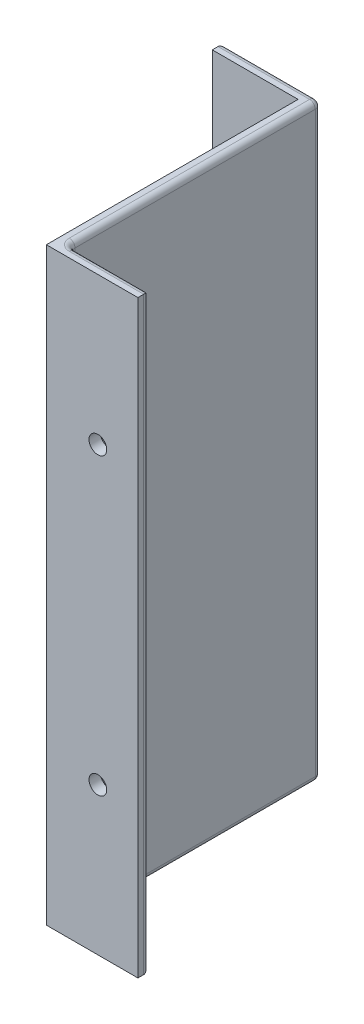
from build123d import *

# Parameters (mm, degrees)
RESSALTO_EXTRUS_O1_DEPTH = 103
ESBO_O2_R                = 1.55
CORTE_EXTRUS_O1_DEPTH    = 2
CORTE_EXTRUS_O2_DEPTH    = 0.5
FILETE1_R                = 1


with BuildPart() as part:
    # Esboço1 → Ressalto-extrusão1 (new body)
    with BuildSketch(Plane(origin=(0, 0, 0), x_dir=(1, 0, 0), z_dir=(0, 1, 0))):
        Polygon((0, 0), (16, 0), (16, 2), (2, 2), (2, 46), (-15, 46), (-15, 44), (0, 44), align=None)
    extrude(amount=RESSALTO_EXTRUS_O1_DEPTH)

    # Esboço2 → Corte-extrusão1 (cut)
    with BuildSketch(Plane(origin=(0, 0, -2), x_dir=(-1, 0, 0), z_dir=(0, 0, -1))):
        with Locations((-9, 77.25)):
            Circle(ESBO_O2_R)
        with Locations((-9, 25.75)):
            Circle(ESBO_O2_R)
    extrude(amount=-CORTE_EXTRUS_O1_DEPTH, mode=Mode.SUBTRACT)

    # Esboço3 → Corte-extrusão2 (cut)
    # profile 1 of 8: a face of its own
    with BuildSketch(Plane(origin=(0, 0, -2), x_dir=(-1, 0, 0), z_dir=(0, 0, -1))):
        Polygon((-12.5, 60.721153846), (-12.5, 61.057692308), (-9.743890224, 62.223657853), (-12.5, 63.390324519), (-12.5, 63.727564103), (-9, 62.246794872), (-9, 62.201923077), align=None)
    # profile 2 of 8: a face of its own
    with BuildSketch(Plane(origin=(0, 0, -2), x_dir=(-1, 0, 0), z_dir=(0, 0, -1))):
        with BuildLine():
            Line((-11.423076923, 58.432692308), (-11.423076923, 58.118589744))
            add(Edge.make_bspline(
                [(-11.423076923, 58.118589744), (-11.464747811, 58.120636897), (-11.546588325, 58.124657451), (-11.665912232, 58.14348574), (-11.779967031, 58.170426617), (-11.887836945, 58.208518071), (-11.990475752, 58.255824349), (-12.087475767, 58.312554376), (-12.178466956, 58.379748227), (-12.262605799, 58.455954961), (-12.33979337, 58.5387236), (-12.406448613, 58.628029539), (-12.462766284, 58.721874567), (-12.509847526, 58.819973966), (-12.545187372, 58.923434529), (-12.571409012, 59.031317387), (-12.587185357, 59.144096523), (-12.588881143, 59.220936545), (-12.58974359, 59.260016026)],
                knots=[0, 0, 0, 0, 1.10065271, 2.161652631, 3.183658789, 4.190468796, 5.17591951, 6.163126047, 7.15150782, 8.156236427, 9.156009102, 10.134482811, 11.092018607, 12.041330605, 13.001268258, 13.972401359, 14.968799086, 16, 16, 16, 16], degree=3))
            add(Edge.make_bspline(
                [(-12.58974359, 59.260016026), (-12.588852424, 59.298396801), (-12.587101316, 59.373813652), (-12.571837144, 59.483837459), (-12.54844616, 59.588826559), (-12.513784407, 59.687591109), (-12.47029149, 59.781144713), (-12.416202348, 59.868329021), (-12.354076299, 59.951252241), (-12.280795578, 60.025844646), (-12.202604863, 60.094366768), (-12.119097837, 60.153428695), (-12.032749001, 60.204293291), (-11.942883845, 60.245924374), (-11.849209723, 60.277482586), (-11.752624723, 60.300864197), (-11.652014188, 60.314230389), (-11.583905673, 60.316270491), (-11.549278846, 60.317307692)],
                knots=[0, 0, 0, 0, 1.111674182, 2.184400057, 3.212814286, 4.223731311, 5.211378316, 6.196328225, 7.191884489, 8.207283132, 9.220262353, 10.201199469, 11.166417575, 12.120932471, 13.06540007, 14.026332106, 14.996573967, 16, 16, 16, 16], degree=3))
            add(Edge.make_bspline(
                [(-11.549278846, 60.317307692), (-11.500530165, 60.315615866), (-11.403888274, 60.312261902), (-11.261885815, 60.283526473), (-11.12424519, 60.238760085), (-11.013479624, 60.184415929), (-10.924023761, 60.130564808), (-10.8505287, 60.081718469), (-10.771712368, 60.024110035), (-10.686615211, 59.95820849), (-10.596722591, 59.882657453), (-10.499528359, 59.800472163), (-10.398131849, 59.707985246), (-10.328796454, 59.643361966), (-10.29286859, 59.609875801)],
                knots=[0, 0, 0, 0, 1.184287764, 2.347792955, 3.508658517, 4.695561027, 5.337795753, 6.047029248, 6.840419152, 7.71111932, 8.663527678, 9.695323177, 10.80577421, 12, 12, 12, 12], degree=3))
            Line((-10.29286859, 59.609875801), (-9.358974359, 58.734174679))
            Line((-9.358974359, 58.734174679), (-9.358974359, 60.362179487))
            Line((-9.358974359, 60.362179487), (-9, 60.362179487))
            Line((-9, 60.362179487), (-9, 57.983974359))
            Line((-9, 57.983974359), (-10.448517628, 59.341346154))
            add(Edge.make_bspline(
                [(-10.448517628, 59.341346154), (-10.483015935, 59.374394041), (-10.549280121, 59.437872268), (-10.646023081, 59.527654845), (-10.735772622, 59.608293833), (-10.818359171, 59.680311226), (-10.894990738, 59.742144731), (-10.963185442, 59.797016963), (-11.025939892, 59.840982554), (-11.098680506, 59.88869795), (-11.187492823, 59.934911931), (-11.296026513, 59.974624287), (-11.407753765, 59.998839136), (-11.483255802, 60.001743971), (-11.521233974, 60.003205128)],
                knots=[0, 0, 0, 0, 1.329631726, 2.553950428, 3.673215718, 4.687767853, 5.603093632, 6.413772471, 7.123043292, 7.734684054, 8.834405432, 9.900288307, 10.943827018, 12, 12, 12, 12], degree=3))
            add(Edge.make_bspline(
                [(-11.521233974, 60.003205128), (-11.545115373, 60.002569386), (-11.592181023, 60.00131646), (-11.661186782, 59.990258762), (-11.727751596, 59.973548256), (-11.792080215, 59.949602998), (-11.853525867, 59.917996258), (-11.912163347, 59.879522878), (-11.968852313, 59.835132815), (-12.022005611, 59.783781546), (-12.070686816, 59.727370026), (-12.113810902, 59.667775776), (-12.149850012, 59.604725672), (-12.179393509, 59.53848555), (-12.202568891, 59.46924008), (-12.21862747, 59.396855335), (-12.228709954, 59.321531319), (-12.230074126, 59.270097823), (-12.230769231, 59.243890224)],
                knots=[0, 0, 0, 0, 0.991446411, 1.95395049, 2.89581595, 3.838931463, 4.798493298, 5.75982156, 6.748411868, 7.785213223, 8.824556874, 9.840280684, 10.836137867, 11.835679398, 12.848801643, 13.863922112, 14.911575587, 16, 16, 16, 16], degree=3))
            add(Edge.make_bspline(
                [(-12.230769231, 59.243890224), (-12.230082413, 59.216512522), (-12.228733615, 59.162747234), (-12.218517149, 59.083975444), (-12.203028983, 59.008311704), (-12.178430394, 58.936884984), (-12.149365939, 58.868148585), (-12.11244268, 58.803569919), (-12.069537034, 58.742076784), (-12.019786187, 58.684680621), (-11.963887514, 58.632259658), (-11.902283318, 58.585553337), (-11.835417099, 58.545012256), (-11.76356329, 58.509591138), (-11.686006495, 58.480838784), (-11.603039645, 58.458864688), (-11.515018024, 58.441478106), (-11.454232973, 58.435669548), (-11.423076923, 58.432692308)],
                knots=[0, 0, 0, 0, 1.030878251, 2.024474673, 2.987898669, 3.934362936, 4.864849709, 5.795128259, 6.730474222, 7.685293701, 8.650606017, 9.611896181, 10.591709709, 11.591680886, 12.625074257, 13.701333388, 14.821793024, 16, 16, 16, 16], degree=3))
        make_face()
    # profile 3 of 8: a face of its own
    with BuildSketch(Plane(origin=(0, 0, -2), x_dir=(-1, 0, 0), z_dir=(0, 0, -1))):
        Polygon((-12.5, 56.035556891), (-12.5, 56.682692308), (-9, 56.682692308), (-9, 56.368589744), (-12.141025641, 56.368589744), (-12.141025641, 55.830128205), align=None)
    # profile 4 of 8: a face of its own
    with BuildSketch(Plane(origin=(0, 0, -2), x_dir=(-1, 0, 0), z_dir=(0, 0, -1))):
        Polygon((-12.5, 51.657051282), (-12.5, 53.631410256), (-12.141025641, 53.631410256), (-12.141025641, 51.971153846), (-11.064102564, 51.971153846), (-11.064102564, 53.631410256), (-10.705128205, 53.631410256), (-10.705128205, 51.971153846), (-9.358974359, 51.971153846), (-9.358974359, 53.631410256), (-9, 53.631410256), (-9, 51.657051282), align=None)
    # profile 5 of 8: a face of its own
    with BuildSketch(Plane(origin=(0, 0, -2), x_dir=(-1, 0, 0), z_dir=(0, 0, -1))):
        Polygon((-12.141025641, 49.189102564), (-12.5, 49.189102564), (-12.5, 51.028846154), (-12.141025641, 51.028846154), (-12.141025641, 50.266025641), (-9, 50.266025641), (-9, 49.951923077), (-12.141025641, 49.951923077), align=None)
    # profile 6 of 8: a face of its own
    with BuildSketch(Plane(origin=(0, 0, -2), x_dir=(-1, 0, 0), z_dir=(0, 0, -1))):
        Polygon((-9, 46.003205128), (-12.5, 46.003205128), (-12.5, 46.069110577), (-9.745292468, 48.381410256), (-12.5, 48.381410256), (-12.5, 48.695512821), (-9, 48.695512821), (-9, 48.623998397), (-11.748397436, 46.317307692), (-9, 46.317307692), align=None)
    # profile 7 of 8: a face of its own
    with BuildSketch(Plane(origin=(0, 0, -2), x_dir=(-1, 0, 0), z_dir=(0, 0, -1))):
        with BuildLine():
            add(Edge.make_bspline(
                [(-12.58974359, 43.423076923), (-12.588129744, 43.487892095), (-12.584960018, 43.61519444), (-12.559895231, 43.802115963), (-12.518641215, 43.981101701), (-12.460381735, 44.152254553), (-12.384855641, 44.314923583), (-12.293113066, 44.469568209), (-12.184596472, 44.615724978), (-12.060899323, 44.752387834), (-11.925430757, 44.877056019), (-11.780409088, 44.986452998), (-11.62765762, 45.078739675), (-11.467168388, 45.154286371), (-11.299316087, 45.213595534), (-11.123159994, 45.2545117), (-10.939853875, 45.280650636), (-10.814826932, 45.283706305), (-10.751402244, 45.28525641)],
                knots=[0, 0, 0, 0, 1.065064174, 2.09187391, 3.093564831, 4.079973196, 5.057907931, 6.036227367, 7.030399151, 8.044883615, 9.061699972, 10.052012555, 11.025713132, 11.989727027, 12.962874294, 13.945865945, 14.957962116, 16, 16, 16, 16], degree=3))
            add(Edge.make_bspline(
                [(-10.751402244, 45.28525641), (-10.688445124, 45.283705784), (-10.564349346, 45.280649319), (-10.382201223, 45.254490491), (-10.207127705, 45.213412964), (-10.039519009, 45.155020699), (-9.879355736, 45.079416032), (-9.726488631, 44.986993495), (-9.581079609, 44.877804139), (-9.444677774, 44.753665359), (-9.319901677, 44.617938723), (-9.2098443, 44.473474414), (-9.11751745, 44.320727019), (-9.041127343, 44.161279455), (-8.983054174, 43.993879686), (-8.94077499, 43.819745885), (-8.914895539, 43.637929312), (-8.911819755, 43.514074262), (-8.91025641, 43.451121795)],
                knots=[0, 0, 0, 0, 1.043748596, 2.057349401, 3.045489418, 4.02252776, 4.995289225, 5.97782527, 6.980224157, 8.006516136, 9.032559198, 10.034193337, 11.013412982, 11.987833483, 12.961212594, 13.946489799, 14.956251404, 16, 16, 16, 16], degree=3))
            add(Edge.make_bspline(
                [(-8.91025641, 43.451121795), (-8.911805797, 43.387697476), (-8.914860051, 43.26267126), (-8.941041456, 43.079134225), (-8.98198276, 42.902856481), (-9.040492196, 42.73434213), (-9.116109427, 42.5734972), (-9.208313806, 42.420007117), (-9.317720947, 42.27448797), (-9.441887521, 42.138146223), (-9.577059073, 42.013397025), (-9.721893329, 41.90463765), (-9.873548785, 41.812412536), (-10.032446309, 41.737049204), (-10.197817752, 41.677384744), (-10.370766229, 41.636679926), (-10.550305735, 41.610343974), (-10.672548634, 41.607309128), (-10.734575321, 41.605769231)],
                knots=[0, 0, 0, 0, 1.053102029, 2.075944431, 3.073151272, 4.055350789, 5.033113405, 6.020478099, 7.024410459, 8.052272461, 9.079885166, 10.07527673, 11.055994387, 12.023226415, 12.992069828, 13.970394897, 14.97016774, 16, 16, 16, 16], degree=3))
            add(Edge.make_bspline(
                [(-10.734575321, 41.605769231), (-10.77620799, 41.606303866), (-10.858948113, 41.607366393), (-10.981814713, 41.620158085), (-11.102705371, 41.638719786), (-11.221276319, 41.665321699), (-11.337237304, 41.700113366), (-11.451388067, 41.741165393), (-11.56257179, 41.791305239), (-11.671315182, 41.847985887), (-11.775923088, 41.911247695), (-11.874802671, 41.981123444), (-11.968783668, 42.055158813), (-12.055430672, 42.136322206), (-12.137264328, 42.221938651), (-12.213027045, 42.31339703), (-12.283401996, 42.410139274), (-12.346822337, 42.512581654), (-12.404181472, 42.618199929), (-12.453403323, 42.727076706), (-12.495649384, 42.837733278), (-12.529890209, 42.950687926), (-12.556922245, 43.065640698), (-12.575329599, 43.182842482), (-12.588153917, 43.302199909), (-12.589211419, 43.382611228), (-12.58974359, 43.423076923)],
                knots=[0, 0, 0, 0, 1.037015668, 2.060948919, 3.074880161, 4.083647147, 5.086022904, 6.090072063, 7.104153813, 8.122640571, 9.144368836, 10.147691507, 11.138137339, 12.123020368, 13.103399296, 14.087645067, 15.080126199, 16.082011238, 17.087798457, 18.072939717, 19.057185487, 20.037253025, 21.01195951, 21.997135196, 22.992090687, 24, 24, 24, 24], degree=3))
        make_face()
        with BuildLine():
            add(Edge.make_bspline(
                [(-12.230769231, 43.438501603), (-12.230365753, 43.405286544), (-12.229562654, 43.339173966), (-12.21892606, 43.24089571), (-12.203874783, 43.14388013), (-12.182015052, 43.048314965), (-12.153740439, 42.953999796), (-12.119639024, 42.860892752), (-12.078422353, 42.769313065), (-12.032069199, 42.679375145), (-11.979419431, 42.593156263), (-11.92351052, 42.510448779), (-11.862265147, 42.433403984), (-11.797007836, 42.3609635), (-11.727172255, 42.293307478), (-11.653217023, 42.23046576), (-11.574822262, 42.17248988), (-11.492310601, 42.120077551), (-11.40614272, 42.07343467), (-11.317965778, 42.031673343), (-11.226743513, 41.997054796), (-11.133045178, 41.969631749), (-11.037283681, 41.946355866), (-10.93893728, 41.93175551), (-10.838345009, 41.921014112), (-10.770362768, 41.920255499), (-10.735977564, 41.919871795)],
                knots=[0, 0, 0, 0, 1.008406545, 2.007172654, 2.999155034, 3.989332444, 4.982025741, 5.988181096, 6.998684226, 8.030553839, 9.059268815, 10.065399129, 11.060956322, 12.046057109, 13.024974577, 14.012068307, 14.991706172, 15.984221787, 16.978487447, 17.966117052, 18.945677757, 19.938371053, 20.93015022, 21.936155317, 22.956113857, 24, 24, 24, 24], degree=3))
            add(Edge.make_bspline(
                [(-10.735977564, 41.919871795), (-10.685416493, 41.921149574), (-10.585947224, 41.92366336), (-10.440162679, 41.945579314), (-10.299921154, 41.979605997), (-10.166058545, 42.02893826), (-10.037977921, 42.091871297), (-9.916177726, 42.168636824), (-9.80069389, 42.259937855), (-9.692386073, 42.363586807), (-9.593568594, 42.476924205), (-9.50670751, 42.59721416), (-9.433602799, 42.723504981), (-9.372488904, 42.855068762), (-9.326448237, 42.993028771), (-9.293621264, 43.136500462), (-9.272345169, 43.285487005), (-9.270278754, 43.3870127), (-9.269230769, 43.438501603)],
                knots=[0, 0, 0, 0, 1.032022337, 2.030307203, 3.003823408, 3.974715386, 4.937372378, 5.913284036, 6.909147208, 7.938749767, 8.970518239, 9.975863271, 10.963918693, 11.946286286, 12.933361397, 13.927862637, 14.949112547, 16, 16, 16, 16], degree=3))
            add(Edge.make_bspline(
                [(-9.269230769, 43.438501603), (-9.26970589, 43.47311124), (-9.270648197, 43.541752547), (-9.280152496, 43.643846073), (-9.295363267, 43.744109775), (-9.317371822, 43.8423584), (-9.344552167, 43.938720673), (-9.378266584, 44.032905837), (-9.418682089, 44.124882609), (-9.463723833, 44.215103258), (-9.514890039, 44.301547657), (-9.570045247, 44.383753456), (-9.630209968, 44.460665514), (-9.694590845, 44.53307201), (-9.764211752, 44.600253878), (-9.837717532, 44.662916673), (-9.916278677, 44.719890134), (-9.99845239, 44.772124784), (-10.083992054, 44.819336779), (-10.172411414, 44.859890148), (-10.263236245, 44.894523564), (-10.356533279, 44.922442021), (-10.452092652, 44.944330197), (-10.550051131, 44.95940938), (-10.650210365, 44.969958018), (-10.717954236, 44.970753068), (-10.752103365, 44.971153846)],
                knots=[0, 0, 0, 0, 1.047334373, 2.07717862, 3.100662057, 4.115010574, 5.122652213, 6.129548646, 7.140165612, 8.16200981, 9.179904151, 10.178566626, 11.156366481, 12.133321541, 13.108841334, 14.082538371, 15.054589433, 16.043660176, 17.028268541, 18.009491307, 18.985652105, 19.968123554, 20.954864208, 21.950389976, 22.966808393, 24, 24, 24, 24], degree=3))
            add(Edge.make_bspline(
                [(-10.752103365, 44.971153846), (-10.78601887, 44.970752733), (-10.85329652, 44.969957052), (-10.952757338, 44.959414577), (-11.05001055, 44.944313687), (-11.144674352, 44.922550978), (-11.236772879, 44.894500826), (-11.326219621, 44.859913492), (-11.413347837, 44.819128206), (-11.497942055, 44.772319928), (-11.579117087, 44.719704305), (-11.65671841, 44.662209319), (-11.729295218, 44.598846743), (-11.798614701, 44.531410349), (-11.863290324, 44.458278819), (-11.923072192, 44.379439389), (-11.980653876, 44.29685506), (-12.031614304, 44.208658248), (-12.0789118, 44.11796248), (-12.119263823, 44.024812838), (-12.153920496, 43.930539635), (-12.182099457, 43.834765951), (-12.20379105, 43.737537055), (-12.218939529, 43.63890949), (-12.229559, 43.539227521), (-12.23036454, 43.472183455), (-12.230769231, 43.438501603)],
                knots=[0, 0, 0, 0, 1.029877221, 2.042951179, 3.035109885, 4.018542222, 4.991021277, 5.957494829, 6.929429462, 7.911425532, 8.892163142, 9.866273635, 10.842761649, 11.81676864, 12.802607151, 13.805177466, 14.821356543, 15.858816981, 16.897175917, 17.927346774, 18.940346092, 19.946830556, 20.957962087, 21.964146003, 22.97721996, 24, 24, 24, 24], degree=3))
        make_face(mode=Mode.SUBTRACT)
    # profile 8 of 8: a face of its own
    with BuildSketch(Plane(origin=(0, 0, -2), x_dir=(-1, 0, 0), z_dir=(0, 0, -1))):
        Polygon((-12.5, 39.451923077), (-12.5, 41.157051282), (-12.141025641, 41.157051282), (-12.141025641, 39.766025641), (-11.064102564, 39.766025641), (-11.064102564, 41.157051282), (-10.705128205, 41.157051282), (-10.705128205, 39.766025641), (-9, 39.766025641), (-9, 39.451923077), align=None)
    extrude(amount=-CORTE_EXTRUS_O2_DEPTH, mode=Mode.SUBTRACT)

    # Filete1
    filete1_edges = [part.edges().sort_by_distance(p)[0] for p in [
        (9, 103, -2),
        (9, 0, -2),
        (2, 51.5, -2),
        (2, 103, -24),
        (2, 0, -24),
        (-6.5, 103, -46),
        (-15, 51.5, -46),
        (-6.5, 0, -46),
        (16, 51.5, -2),
        (2, 51.5, -46),
    ]]
    fillet(filete1_edges, radius=FILETE1_R)


solid = part.part
